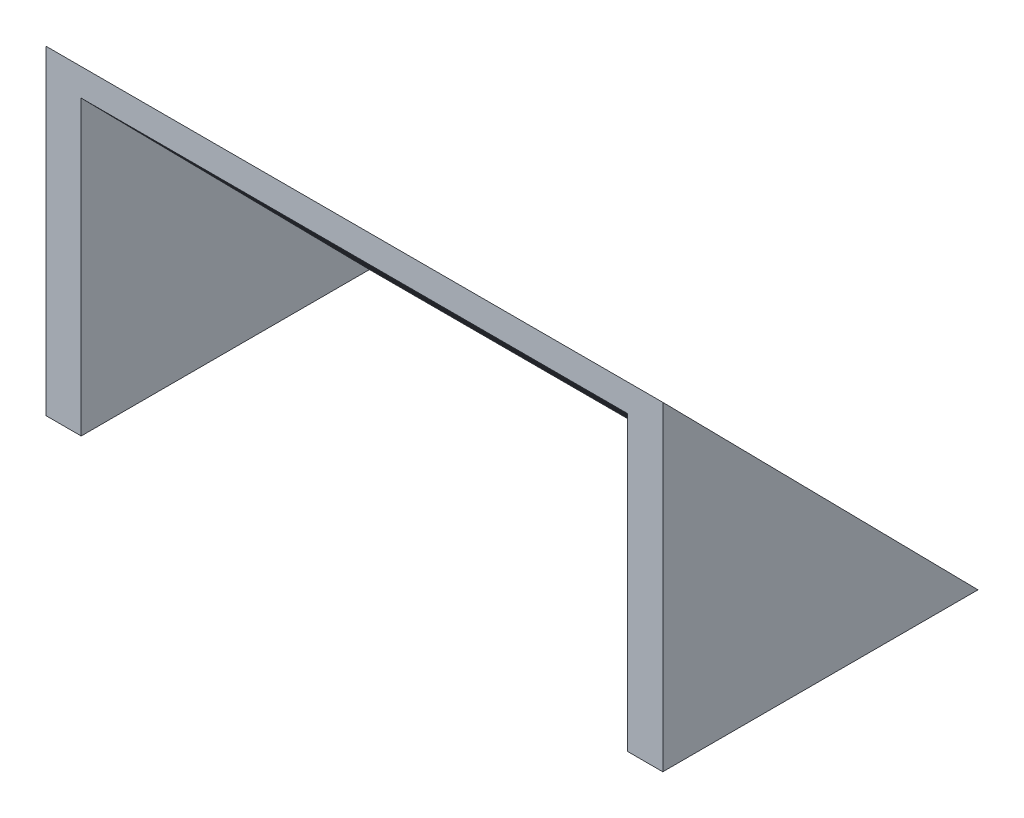
from build123d import *

# Parameters (mm, degrees)
P_IDAT_VYSUNUT_M1_DEPTH  = 2.2
SKICA2_W                 = 35.15
SKICA2_H                 = 28.072940708
P_IDAT_VYSUNUT_M2_DEPTH  = 1.2
LINPOLE1_COUNT           = 2
LINPOLE1_PITCH           = 36.35
SKICA3_W                 = 2.46853356
SKICA3_H                 = 4.337658353
SKICA3_W_2               = 5.363858138
SKICA3_H_2               = 3.395185275
ODEBRAT_VYSUNUT_M1_DEPTH = 48.68849442


with BuildPart() as part:
    # Skica1 → Přidat vysunutím1 (new body)
    with BuildSketch(Plane(origin=(0, 0, 0), x_dir=(0, 0, -1), z_dir=(1, 0, 0))):
        Polygon((0, 0), (0, 20), (19.7, 0), align=None)
    p_idat_vysunut_m1 = extrude(amount=P_IDAT_VYSUNUT_M1_DEPTH)

    # Skica2 → Přidat vysunutím2 (add)
    with BuildSketch(Plane(origin=(0, 9.848875128, -9.998857998), x_dir=(-1, 0, 0), z_dir=(0, 0.7017433693479112, -0.7124298165968641))):
        with Locations((-19.775, 0.212125978)):
            Rectangle(SKICA2_W, SKICA2_H)
    extrude(amount=-P_IDAT_VYSUNUT_M2_DEPTH)

    # LinPole1: Přidat vysunutím1 ×2
    with Locations(*[(i * LINPOLE1_PITCH, 0, 0) for i in range(1, LINPOLE1_COUNT)]):
        add(p_idat_vysunut_m1)

    # Skica3 → Odebrat vysunutím1 (cut, through all)
    with BuildSketch(Plane(origin=(38.55, 0, 0), x_dir=(0, 0, -1), z_dir=(1, 0, 0))):
        with Locations((-1.23426678, 19.003869159)):
            Rectangle(SKICA3_W, SKICA3_H)
        with Locations((19.532023183, -1.697592638)):
            Rectangle(SKICA3_W_2, SKICA3_H_2)
    extrude(amount=-ODEBRAT_VYSUNUT_M1_DEPTH, mode=Mode.SUBTRACT)


solid = part.part
